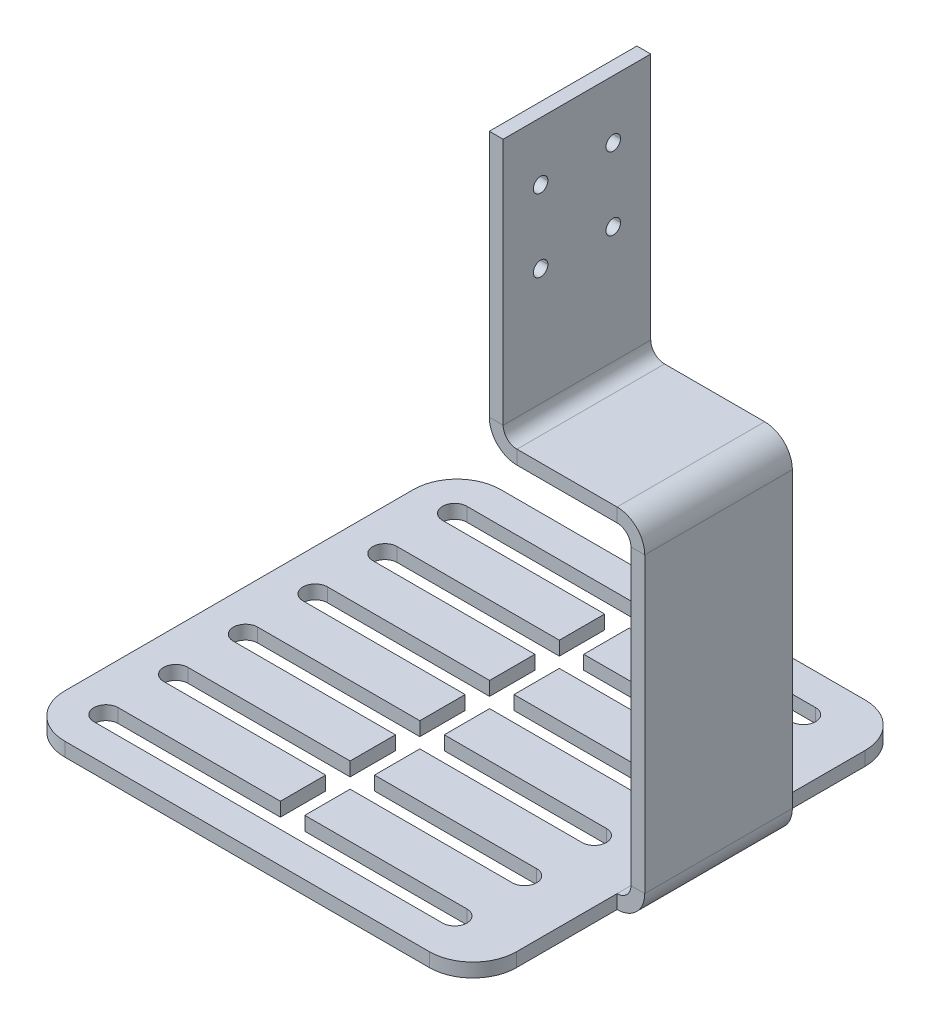
from build123d import *

# Parameters (mm, degrees)
BRIDA_BASE1_DEPTH           = 75
CORTAR_EXTRUIR1_START       = -9.525
CORTAR_EXTRUIR1_OUTLINE_W   = 49.6
CORTAR_EXTRUIR1_OUTLINE_H   = 121
CORTAR_EXTRUIR1_DEPTH       = 9.525
CORTAR_EXTRUIR1_START_2     = -53.5025
CORTAR_EXTRUIR1_2_OUTLINE_W = 49.6
CORTAR_EXTRUIR1_2_OUTLINE_H = 94.7625
CORTAR_EXTRUIR1_2_DEPTH     = 43.9775
CORTAR_EXTRUIR2_DEPTH       = 10
CORTAR_EXTRUIR3_DEPTH       = 10
REDONDEO1_R                 = 15


# Read off the part's stored shape, not the designer's step: Cortar-Extruir1
# Sheet-metal steps are written as plain solids
with BuildPart() as part:
    # Croquis1 → Brida base1 (new, symmetric)
    with BuildSketch(Plane.XY):
        with BuildLine():
            Line((33.76, 105), (33.76, 19.7625))
            ThreePointArc((33.76, 19.7625), (35.154903955, 16.394903955), (38.5225, 15))
            Line((38.5225, 15), (72.975, 15))
            ThreePointArc((72.975, 15), (79.710192091, 12.210192091), (82.5, 5.475))
            Line((82.5, 5.475), (82.5, -95.475))
            ThreePointArc((82.5, -95.475), (79.710192091, -102.210192091), (72.975, -105))
            Line((72.975, -105), (-82.5, -105))
            Line((-82.5, -105), (-82.5, -100.2375))
            Line((-82.5, -100.2375), (72.975, -100.2375))
            ThreePointArc((72.975, -100.2375), (76.342596045, -98.842596045), (77.7375, -95.475))
            Line((77.7375, -95.475), (77.7375, 5.475))
            ThreePointArc((77.7375, 5.475), (76.342596045, 8.842596045), (72.975, 10.2375))
            Line((72.975, 10.2375), (38.5225, 10.2375))
            ThreePointArc((38.5225, 10.2375), (31.787307909, 13.027307909), (28.9975, 19.7625))
            Line((28.9975, 19.7625), (28.9975, 105))
            Line((28.9975, 105), (33.76, 105))
        make_face()
    extrude(amount=BRIDA_BASE1_DEPTH, both=True)

    # Cortar-Extruir1 outline → Cortar-Extruir1 (cut)
    with BuildSketch(Plane(origin=(82.5, 0, 0), x_dir=(0, 0, -1), z_dir=(1, 0, 0)).offset(CORTAR_EXTRUIR1_START)):
        with Locations((50.2, -45.5)):
            Rectangle(CORTAR_EXTRUIR1_OUTLINE_W, CORTAR_EXTRUIR1_OUTLINE_H)
        with Locations((-50.2, -45.5)):
            Rectangle(CORTAR_EXTRUIR1_OUTLINE_W, CORTAR_EXTRUIR1_OUTLINE_H)
    extrude(amount=CORTAR_EXTRUIR1_DEPTH, mode=Mode.SUBTRACT)

    # Cortar-Extruir1 2 outline → Cortar-Extruir1 2 (cut)
    with BuildSketch(Plane(origin=(82.5, 0, 0), x_dir=(0, 0, -1), z_dir=(1, 0, 0)).offset(CORTAR_EXTRUIR1_START_2)):
        with Locations((50.2, 57.61875)):
            Rectangle(CORTAR_EXTRUIR1_2_OUTLINE_W, CORTAR_EXTRUIR1_2_OUTLINE_H)
        with Locations((-50.2, 57.61875)):
            Rectangle(CORTAR_EXTRUIR1_2_OUTLINE_W, CORTAR_EXTRUIR1_2_OUTLINE_H)
    extrude(amount=CORTAR_EXTRUIR1_2_DEPTH, mode=Mode.SUBTRACT)

    # Croquis7 → Cortar-Extruir2 (cut)
    with BuildSketch(Plane(origin=(33.76, 0, 0), x_dir=(0, 0, -1), z_dir=(1, 0, 0))):
        with BuildLine():
            ThreePointArc((-15, 84.9995), (-12.5, 82.4995), (-10, 84.9995))
            ThreePointArc((-10, 84.9995), (-12.5, 87.5005), (-15, 84.9995))
        make_face()
        with BuildLine():
            ThreePointArc((10, 84.9995), (12.5, 82.4995), (15, 84.9995))
            ThreePointArc((15, 84.9995), (12.5, 87.5005), (10, 84.9995))
        make_face()
        with BuildLine():
            ThreePointArc((10, 59.9995), (12.5, 57.4995), (15, 59.9995))
            ThreePointArc((15, 59.9995), (12.5, 62.5005), (10, 59.9995))
        make_face()
        with BuildLine():
            ThreePointArc((-15, 59.9995), (-12.5, 57.4995), (-10, 59.9995))
            ThreePointArc((-10, 59.9995), (-12.5, 62.5005), (-15, 59.9995))
        make_face()
    extrude(amount=-CORTAR_EXTRUIR2_DEPTH, mode=Mode.SUBTRACT)

    # Croquis8 → Cortar-Extruir3 (cut)
    with BuildSketch(Plane.XZ.offset(105)):
        with BuildLine():
            Line((-68.3, -64.2), (51.7, -64.2))
            ThreePointArc((51.7, -64.2), (55.9, -60), (51.7, -55.8))
            Line((51.7, -55.8), (-4.1, -55.8))
            Line((-4.1, -55.8), (-4.1, -40.2))
            Line((-4.1, -40.2), (51.7, -40.2))
            ThreePointArc((51.7, -40.2), (55.9, -36), (51.7, -31.8))
            Line((51.7, -31.8), (-4.1, -31.8))
            Line((-4.1, -31.8), (-4.1, -16.2))
            Line((-4.1, -16.2), (51.7, -16.2))
            ThreePointArc((51.7, -16.2), (55.9, -12), (51.7, -7.8))
            Line((51.7, -7.8), (-4.1, -7.8))
            Line((-4.1, -7.8), (-4.1, 7.8))
            Line((-4.1, 7.8), (51.7, 7.8))
            ThreePointArc((51.7, 7.8), (55.9, 12), (51.7, 16.2))
            Line((51.7, 16.2), (-4.1, 16.2))
            Line((-4.1, 16.2), (-4.1, 31.8))
            Line((-4.1, 31.8), (51.7, 31.8))
            ThreePointArc((51.7, 31.8), (55.9, 36), (51.7, 40.2))
            Line((51.7, 40.2), (-4.1, 40.2))
            Line((-4.1, 40.2), (-4.1, 55.8))
            Line((-4.1, 55.8), (51.7, 55.8))
            ThreePointArc((51.7, 55.8), (55.9, 60), (51.7, 64.2))
            Line((51.7, 64.2), (-68.3, 64.2))
            ThreePointArc((-68.3, 64.2), (-72.5, 60), (-68.3, 55.8))
            Line((-68.3, 55.8), (-12.5, 55.8))
            Line((-12.5, 55.8), (-12.5, 40.2))
            Line((-12.5, 40.2), (-68.3, 40.2))
            ThreePointArc((-68.3, 40.2), (-72.5, 36), (-68.3, 31.8))
            Line((-68.3, 31.8), (-12.5, 31.8))
            Line((-12.5, 31.8), (-12.5, 16.2))
            Line((-12.5, 16.2), (-68.3, 16.2))
            ThreePointArc((-68.3, 16.2), (-72.5, 12), (-68.3, 7.8))
            Line((-68.3, 7.8), (-12.5, 7.8))
            Line((-12.5, 7.8), (-12.5, -7.8))
            Line((-12.5, -7.8), (-68.3, -7.8))
            ThreePointArc((-68.3, -7.8), (-72.5, -12), (-68.3, -16.2))
            Line((-68.3, -16.2), (-12.5, -16.2))
            Line((-12.5, -16.2), (-12.5, -31.8))
            Line((-12.5, -31.8), (-68.3, -31.8))
            ThreePointArc((-68.3, -31.8), (-72.5, -36), (-68.3, -40.2))
            Line((-68.3, -40.2), (-12.5, -40.2))
            Line((-12.5, -40.2), (-12.5, -55.8))
            Line((-12.5, -55.8), (-68.3, -55.8))
            ThreePointArc((-68.3, -55.8), (-72.5, -60), (-68.3, -64.2))
        make_face()
    extrude(amount=-CORTAR_EXTRUIR3_DEPTH, mode=Mode.SUBTRACT)

    # Redondeo1
    redondeo1_edges = [part.edges().sort_by_distance(p)[0] for p in [
        (-82.5, -102.61875, -75),
        (72.975, -102.61875, -75),
        (72.975, -102.61875, 75),
        (-82.5, -102.61875, 75),
    ]]
    fillet(redondeo1_edges, radius=REDONDEO1_R)


solid = part.part
